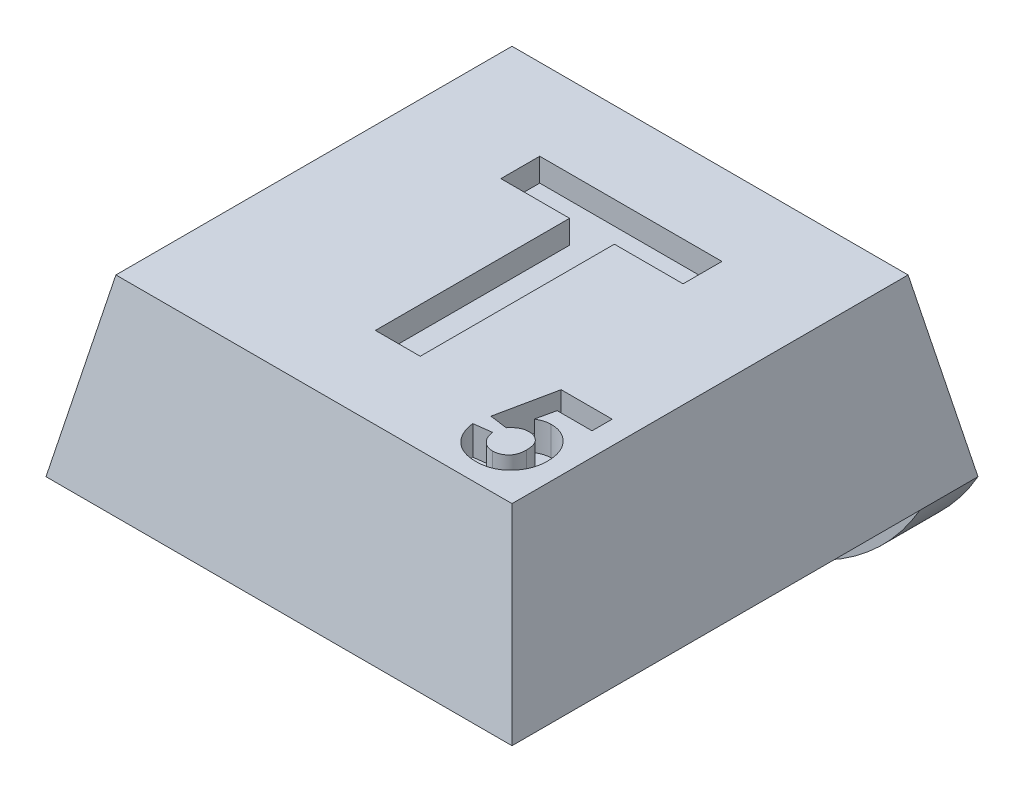
from build123d import *

# Parameters (mm, degrees)
SKETCH1_W               = 8
SKETCH1_H               = 8
BOSS_EXTRUDE1_DEPTH     = 3
CUT_EXTRUDE1_DEPTH      = 12.704699911
CUT_EXTRUDE1_DEPTH_BACK = 12.704699911
CUT_EXTRUDE2_DEPTH      = 11
SKETCH4_R               = 1.75
CUT_EXTRUDE3_DEPTH      = 0.4
SKETCH5_W               = 8
SKETCH5_H               = 1
BOSS_EXTRUDE2_DEPTH     = 2
FILLET1_R               = 4
CUT_EXTRUDE4_DEPTH      = 0.4
CUT_EXTRUDE5_DEPTH      = 0.5


with BuildPart() as part:
    # Sketch1 → Boss-Extrude1 (new body)
    with BuildSketch(Plane(origin=(0, 0, 0), x_dir=(1, 0, 0), z_dir=(0, 1, 0))):
        with Locations((4, 4)):
            Rectangle(SKETCH1_W, SKETCH1_H)
    extrude(amount=BOSS_EXTRUDE1_DEPTH)

    # Sketch2 → Cut-Extrude1 (cut, two sides: drawn at the far end of the back side and taken through both)
    with BuildSketch(Plane.XY.offset(-CUT_EXTRUDE1_DEPTH_BACK)):
        Polygon((0, 0), (0.6, 3), (0, 3), align=None)
        Polygon((8, 0), (7.4, 3), (8, 3), align=None)
    extrude(amount=CUT_EXTRUDE1_DEPTH + CUT_EXTRUDE1_DEPTH_BACK, mode=Mode.SUBTRACT)

    # Sketch3 → Cut-Extrude2 (cut)
    with BuildSketch(Plane(origin=(0, 0, 0), x_dir=(0, 0, -1), z_dir=(1, 0, 0))):
        Polygon((0, 0), (0.6, 3), (0, 3), align=None)
        Polygon((8, 3), (7.4, 3), (8, 0), align=None)
    extrude(amount=CUT_EXTRUDE2_DEPTH, mode=Mode.SUBTRACT)

    # Sketch4 → Cut-Extrude3 (cut)
    with BuildSketch(Plane.XZ):
        with Locations(Location((4, -3.75, 0), (0, 0, 270))):
            Circle(SKETCH4_R)
    extrude(amount=-CUT_EXTRUDE3_DEPTH, mode=Mode.SUBTRACT)

    # Sketch5 → Boss-Extrude2 (add)
    with BuildSketch(Plane.XZ):
        with Locations((4, -7.5)):
            Rectangle(SKETCH5_W, SKETCH5_H)
    extrude(amount=BOSS_EXTRUDE2_DEPTH)

    # Fillet1
    # the kernel refuses this fillet: 4 mm, written as the material it takes off along each edge
    with BuildSketch(Plane(origin=(8, -2, -16.660254038), x_dir=(0, 1, 0), z_dir=(0, 0, 1)), Plane(origin=(0, -2, 1.660254038), x_dir=(0, 1, 0), z_dir=(0, 0, -1))) as fillet1_piece_1:
        with BuildLine():
            CenterArc((4, 3.464101615), FILLET1_R, 180, 60)
            Line((0, 3.464101615), (-0.08, 3.464101615))
            Line((-0.08, 3.464101615), (-0.08, 0))
            Line((-0.08, 0), (0, -0.08))
            ThreePointArc((0, -0.08), (1, -0.08), (1.96, -0.069282032))
            Line((1.96, -0.069282032), (2, 0))
        make_face()
    extrude(amount=18.320508076, mode=Mode.SUBTRACT)

    # Sketch6 → Cut-Extrude4 (cut)
    with BuildSketch(Plane(origin=(0, 3, 0), x_dir=(1, 0, 0), z_dir=(0, 1, 0))):
        Polygon((3.652362984, 2.002856352), (3.652362984, 5.336189685), (2.472875805, 5.336189685), (2.472875805, 6.002856352), (5.601080933, 6.002856352), (5.601080933, 5.336189685), (4.421593754, 5.336189685), (4.421593754, 2.002856352), align=None)
    extrude(amount=-CUT_EXTRUDE4_DEPTH, mode=Mode.SUBTRACT)

    # Sketch7 → Cut-Extrude5 (cut)
    with BuildSketch(Plane(origin=(0, 3, 0), x_dir=(1, 0, 0), z_dir=(0, 1, 0))):
        with BuildLine():
            Line((5.873519392, 1.453659702), (6.173519392, 1.492602009))
            add(Edge.make_bspline(
                [(6.173519392, 1.492602009), (6.1768382, 1.472256976), (6.18322911, 1.433079261), (6.203068429, 1.378384162), (6.230697403, 1.330199963), (6.266205672, 1.289626965), (6.30661854, 1.256629271), (6.351264588, 1.233104776), (6.398791495, 1.218293755), (6.431707248, 1.216554551), (6.448279008, 1.215678932)],
                knots=[0, 0, 0, 0, 1.154848647, 2.223851388, 3.245409892, 4.254330626, 5.232966172, 6.156270698, 7.071756339, 8, 8, 8, 8], degree=3))
            add(Edge.make_bspline(
                [(6.448279008, 1.215678932), (6.457906388, 1.215848075), (6.476752132, 1.216179174), (6.504524052, 1.219937575), (6.531053869, 1.226043662), (6.55659259, 1.234330756), (6.580874213, 1.245230043), (6.603920328, 1.258567919), (6.625817059, 1.274363121), (6.646675237, 1.292223374), (6.665948362, 1.312615024), (6.682055884, 1.336087325), (6.696325112, 1.361440746), (6.707949377, 1.389364059), (6.716328852, 1.41995512), (6.722995329, 1.45269023), (6.726393576, 1.487964606), (6.7270346, 1.51218758), (6.727365546, 1.524693355)],
                knots=[0, 0, 0, 0, 0.981268084, 1.920847364, 2.851509818, 3.754644372, 4.654445699, 5.560569672, 6.465366234, 7.403985617, 8.358004942, 9.316972086, 10.299158387, 11.321223707, 12.392031981, 13.529051644, 14.724304971, 16, 16, 16, 16], degree=3))
            add(Edge.make_bspline(
                [(6.727365546, 1.524693355), (6.727178419, 1.536481523), (6.726816764, 1.559264099), (6.723461454, 1.592272205), (6.718311073, 1.623118586), (6.710117629, 1.651577708), (6.700760071, 1.678178631), (6.688143723, 1.701978526), (6.674300374, 1.724011312), (6.657427434, 1.743088207), (6.639042824, 1.759943867), (6.619463278, 1.774961982), (6.598469004, 1.787493154), (6.576269045, 1.79824857), (6.552478567, 1.806082762), (6.527290541, 1.811294815), (6.501043648, 1.815207497), (6.483029864, 1.815520133), (6.473879969, 1.815678932)],
                knots=[0, 0, 0, 0, 1.29221626, 2.497420946, 3.635005972, 4.715822244, 5.741640361, 6.720139245, 7.663294346, 8.588224307, 9.502291809, 10.395891443, 11.288713187, 12.178904539, 13.095818132, 14.026458458, 14.997562253, 16, 16, 16, 16], degree=3))
            add(Edge.make_bspline(
                [(6.473879969, 1.815678932), (6.462311673, 1.815264192), (6.439232742, 1.814436778), (6.405164091, 1.807710713), (6.372003678, 1.796760631), (6.339785969, 1.781517356), (6.308596201, 1.761859078), (6.278569411, 1.737720606), (6.249190173, 1.70951724), (6.23114374, 1.688207441), (6.2218367, 1.677217394)],
                knots=[0, 0, 0, 0, 0.931687088, 1.85873035, 2.786835662, 3.740075265, 4.723687035, 5.750832598, 6.840042753, 8, 8, 8, 8], degree=3))
            Line((6.2218367, 1.677217394), (5.919673238, 1.719765471))
            Line((5.919673238, 1.719765471), (6.127365546, 2.715678932))
            Line((6.127365546, 2.715678932), (7.004288623, 2.715678932))
            Line((7.004288623, 2.715678932), (7.004288623, 2.369525086))
            Line((7.004288623, 2.369525086), (6.405009777, 2.369525086))
            Line((6.405009777, 2.369525086), (6.3343367, 2.048251048))
            add(Edge.make_bspline(
                [(6.3343367, 2.048251048), (6.352346227, 2.058641979), (6.3874181, 2.078877348), (6.443410579, 2.099707804), (6.499690691, 2.113077126), (6.537629531, 2.114816152), (6.556452085, 2.115678932)],
                knots=[0, 0, 0, 0, 1.060051984, 2.064352337, 3.039669322, 4, 4, 4, 4], degree=3))
            add(Edge.make_bspline(
                [(6.556452085, 2.115678932), (6.574146885, 2.115202759), (6.60910097, 2.114262131), (6.660364054, 2.106544582), (6.709535097, 2.093825268), (6.756780138, 2.076125011), (6.801761249, 2.052924592), (6.844866196, 2.024883357), (6.885472675, 1.991514713), (6.924016987, 1.953782044), (6.959166694, 1.912035385), (6.989521263, 1.866512768), (7.015738821, 1.818347997), (7.037083021, 1.767008911), (7.053155816, 1.712424088), (7.065192785, 1.655063547), (7.07193581, 1.594565079), (7.072984339, 1.553314949), (7.073519392, 1.532265471)],
                knots=[0, 0, 0, 0, 0.974409932, 1.924837087, 2.848242317, 3.768103797, 4.697919751, 5.630842317, 6.595644344, 7.588240789, 8.59876155, 9.595918743, 10.597287627, 11.615415169, 12.652315553, 13.727511434, 14.840374562, 16, 16, 16, 16], degree=3))
            add(Edge.make_bspline(
                [(7.073519392, 1.532265471), (7.073036469, 1.514585649), (7.072077961, 1.479494734), (7.066471429, 1.42756738), (7.056005109, 1.377169317), (7.042672536, 1.328016631), (7.024246745, 1.280521142), (7.002381003, 1.234373213), (6.976242653, 1.189655711), (6.956076521, 1.161441782), (6.945875162, 1.147169317)],
                knots=[0, 0, 0, 0, 1.027524957, 2.039431707, 3.02972907, 4.015954419, 4.995255842, 5.985553205, 6.980960039, 8, 8, 8, 8], degree=3))
            add(Edge.make_bspline(
                [(6.945875162, 1.147169317), (6.931003624, 1.128791302), (6.901734709, 1.092621232), (6.851630217, 1.045066578), (6.797135444, 1.00512898), (6.738397987, 0.97233011), (6.675480422, 0.946591981), (6.608098871, 0.928697649), (6.536747385, 0.917626673), (6.487743367, 0.916337636), (6.462702085, 0.915678932)],
                knots=[0, 0, 0, 0, 1.018121711, 2.003781959, 2.967346956, 3.92281574, 4.896313303, 5.889026666, 6.921282725, 8, 8, 8, 8], degree=3))
            add(Edge.make_bspline(
                [(6.462702085, 0.915678932), (6.442489279, 0.916044029), (6.403022672, 0.9167569), (6.345224712, 0.92380666), (6.290451314, 0.935259909), (6.238356922, 0.95115359), (6.18925085, 0.971795666), (6.142751555, 0.99671717), (6.099246456, 1.026470486), (6.058935891, 1.060830838), (6.021919655, 1.09880899), (5.988902802, 1.140363971), (5.959526451, 1.184800784), (5.934351052, 1.232568443), (5.912895663, 1.28333195), (5.895811978, 1.337351468), (5.881746134, 1.394266746), (5.876291993, 1.433642912), (5.873519392, 1.453659702)],
                knots=[0, 0, 0, 0, 1.098912142, 2.145685936, 3.161086862, 4.139124218, 5.10307886, 6.053641493, 7.003731987, 7.963777669, 8.929946266, 9.883471279, 10.846206077, 11.822909928, 12.81603559, 13.839338588, 14.901632394, 16, 16, 16, 16], degree=3))
        make_face()
    extrude(amount=-CUT_EXTRUDE5_DEPTH, mode=Mode.SUBTRACT)


solid = part.part
